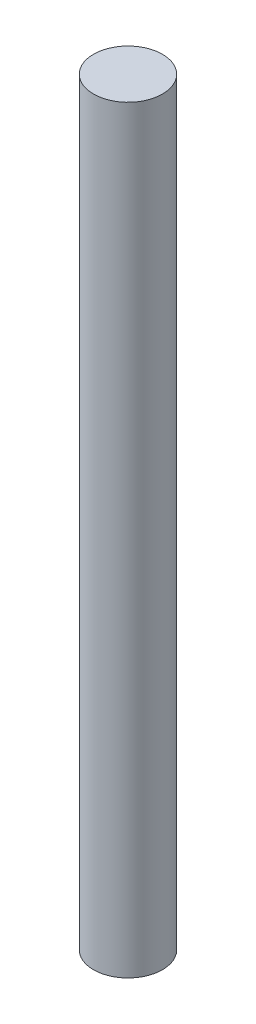
from build123d import *

# Parameters (mm, degrees)
SKETCH1_R           = 1.5
BOSS_EXTRUDE1_DEPTH = 33


with BuildPart() as part:
    # Sketch1 → Boss-Extrude1 (new body)
    with BuildSketch(Plane(origin=(0, 0, 0), x_dir=(1, 0, 0), z_dir=(0, 1, 0))):
        Circle(SKETCH1_R)
    extrude(amount=BOSS_EXTRUDE1_DEPTH)


solid = part.part
